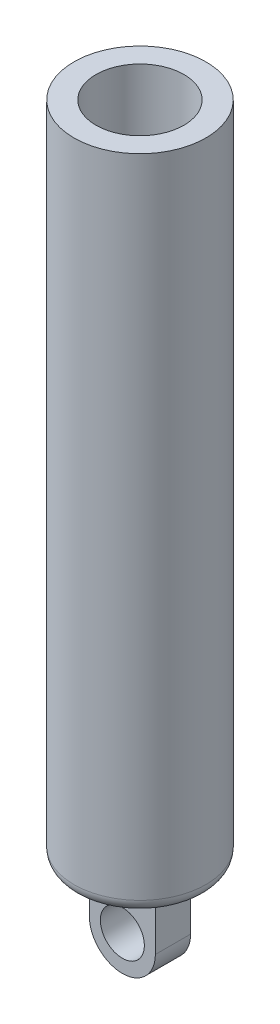
from build123d import *

# Parameters (mm, degrees)
SKETCH1_R           = 15
BOSS_EXTRUDE1_DEPTH = 150
SHELL1_T            = -5
FILLET1_R           = 3
SKETCH2_W           = 15
SKETCH2_H           = 8
BOSS_EXTRUDE2_DEPTH = 20
SKETCH3_R           = 5
CUT_EXTRUDE1_DEPTH  = 152.940777937
FILLET3_R           = 7.5


with BuildPart() as part:
    # Sketch1 → Boss-Extrude1 (new body)
    with BuildSketch(Plane(origin=(0, 0, 0), x_dir=(1, 0, 0), z_dir=(0, 1, 0))):
        with Locations(Location((0, 0, 0), (0, 0, 270))):
            Circle(SKETCH1_R)
    extrude(amount=BOSS_EXTRUDE1_DEPTH)

    # Shell1
    shell1_openings = [part.faces().sort_by_distance(p)[0] for p in [
        (0, 150, 0),
    ]]
    offset(amount=SHELL1_T, openings=shell1_openings, kind=Kind.INTERSECTION)

    # Fillet1
    fillet1_edges = [part.edges().sort_by_distance(p)[0] for p in [
        (0, 0, -15),
    ]]
    fillet(fillet1_edges, radius=FILLET1_R)


with BuildPart() as body_2:
    # Sketch2 → Boss-Extrude2 (new body)
    with BuildSketch(Plane.XZ):
        Rectangle(SKETCH2_W, SKETCH2_H)
    extrude(amount=BOSS_EXTRUDE2_DEPTH)

    # Sketch3 → Cut-Extrude1 (cut, through all)
    with BuildSketch(Plane.XY.offset(4)):
        with Locations((0, -12)):
            Circle(SKETCH3_R)
    extrude(amount=-CUT_EXTRUDE1_DEPTH, mode=Mode.SUBTRACT)

    # Fillet3
    fillet3_edges = [body_2.edges().sort_by_distance(p)[0] for p in [
        (7.5, -20, 0),
        (-7.5, -20, 0),
    ]]
    fillet(fillet3_edges, radius=FILLET3_R - 0.0001)  # a hair under: the kernel refuses the full size


solid = Compound([part.part, body_2.part])
